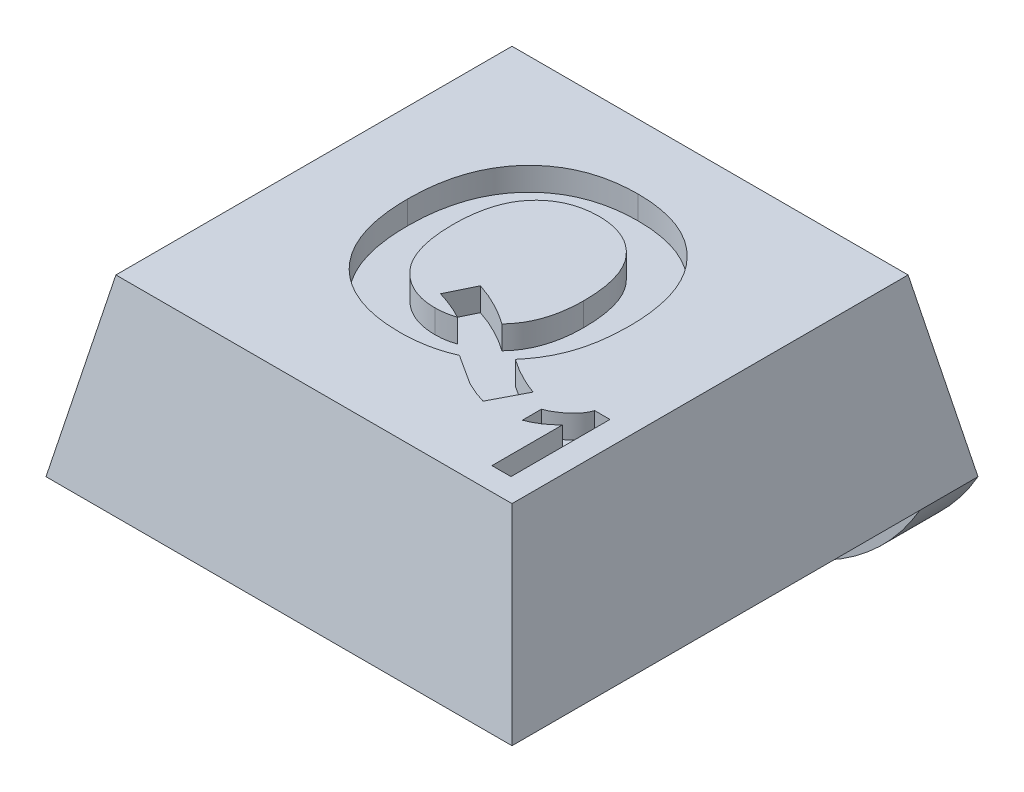
from build123d import *

# Parameters (mm, degrees)
SKETCH1_W               = 8
SKETCH1_H               = 8
BOSS_EXTRUDE1_DEPTH     = 3
CUT_EXTRUDE1_DEPTH      = 12.704699911
CUT_EXTRUDE1_DEPTH_BACK = 12.704699911
CUT_EXTRUDE2_DEPTH      = 11
SKETCH4_R               = 1.8
CUT_EXTRUDE3_DEPTH      = 0.8
SKETCH5_W               = 8
SKETCH5_H               = 1
BOSS_EXTRUDE2_DEPTH     = 2
FILLET1_R               = 4
CUT_EXTRUDE4_DEPTH      = 0.4
CUT_EXTRUDE5_DEPTH      = 0.4


with BuildPart() as part:
    # Sketch1 → Boss-Extrude1 (new body)
    with BuildSketch(Plane(origin=(0, 0, 0), x_dir=(1, 0, 0), z_dir=(0, 1, 0))):
        with Locations((4, 4)):
            Rectangle(SKETCH1_W, SKETCH1_H)
    extrude(amount=BOSS_EXTRUDE1_DEPTH)

    # Sketch2 → Cut-Extrude1 (cut, two sides: drawn at the far end of the back side and taken through both)
    with BuildSketch(Plane.XY.offset(-CUT_EXTRUDE1_DEPTH_BACK)):
        Polygon((0, 0), (0.6, 3), (0, 3), align=None)
        Polygon((8, 0), (7.4, 3), (8, 3), align=None)
    extrude(amount=CUT_EXTRUDE1_DEPTH + CUT_EXTRUDE1_DEPTH_BACK, mode=Mode.SUBTRACT)

    # Sketch3 → Cut-Extrude2 (cut)
    with BuildSketch(Plane(origin=(0, 0, 0), x_dir=(0, 0, -1), z_dir=(1, 0, 0))):
        Polygon((0, 0), (0.6, 3), (0, 3), align=None)
        Polygon((8, 3), (7.4, 3), (8, 0), align=None)
    extrude(amount=CUT_EXTRUDE2_DEPTH, mode=Mode.SUBTRACT)

    # Sketch4 → Cut-Extrude3 (cut)
    with BuildSketch(Plane.XZ):
        with Locations(Location((4, -3.75, 0), (0, 0, 270))):
            Circle(SKETCH4_R)
    extrude(amount=-CUT_EXTRUDE3_DEPTH, mode=Mode.SUBTRACT)

    # Sketch5 → Boss-Extrude2 (add)
    with BuildSketch(Plane.XZ):
        with Locations((4, -7.5)):
            Rectangle(SKETCH5_W, SKETCH5_H)
    extrude(amount=BOSS_EXTRUDE2_DEPTH)

    # Fillet1
    # the kernel refuses this fillet: 4 mm, written as the material it takes off along each edge
    with BuildSketch(Plane(origin=(8, -2, -16.660254038), x_dir=(0, 1, 0), z_dir=(0, 0, 1)), Plane(origin=(0, -2, 1.660254038), x_dir=(0, 1, 0), z_dir=(0, 0, -1))) as fillet1_piece_1:
        with BuildLine():
            CenterArc((4, 3.464101615), FILLET1_R, 180, 60)
            Line((0, 3.464101615), (-0.08, 3.464101615))
            Line((-0.08, 3.464101615), (-0.08, 0))
            Line((-0.08, 0), (0, -0.08))
            ThreePointArc((0, -0.08), (1, -0.08), (1.96, -0.069282032))
            Line((1.96, -0.069282032), (2, 0))
        make_face()
    extrude(amount=18.320508076, mode=Mode.SUBTRACT)

    # Sketch6 → Cut-Extrude4 (cut)
    with BuildSketch(Plane(origin=(0, 3, 0), x_dir=(1, 0, 0), z_dir=(0, 1, 0))):
        with BuildLine():
            add(Edge.make_bspline(
                [(5.284087955, 2.773445367), (5.333545491, 2.739545524), (5.432652736, 2.671614118), (5.590291823, 2.583736248), (5.752942084, 2.503846486), (5.865979951, 2.460876102), (5.92270975, 2.439310751)],
                knots=[0, 0, 0, 0, 0.994855506, 1.99357661, 2.993045438, 4, 4, 4, 4], degree=3))
            Line((5.92270975, 2.439310751), (5.628639237, 1.875208187))
            add(Edge.make_bspline(
                [(5.628639237, 1.875208187), (5.568520037, 1.893818156), (5.447325875, 1.93133395), (5.332925255, 1.986187111), (5.275273852, 2.013829982)],
                knots=[0, 0, 0, 0, 0.992113803, 2, 2, 2, 2], degree=3))
            add(Edge.make_bspline(
                [(5.275273852, 2.013829982), (5.26961656, 2.016684314), (5.253233801, 2.024950075), (5.223476786, 2.045298413), (5.178074812, 2.072724498), (5.118973761, 2.11071311), (5.045578888, 2.157800121), (4.95765273, 2.213934729), (4.856407872, 2.280704114), (4.783596416, 2.327731001), (4.744825134, 2.35277229)],
                knots=[0, 0, 0, 0, 0.241377655, 0.698997227, 1.371388316, 2.263975901, 3.376788369, 4.695767198, 6.240533187, 8, 8, 8, 8], degree=3))
            add(Edge.make_bspline(
                [(4.744825134, 2.35277229), (4.712670389, 2.339001865), (4.648050063, 2.311327899), (4.547788838, 2.27725121), (4.444978029, 2.248544986), (4.339982896, 2.224200245), (4.232359046, 2.206111381), (4.122258624, 2.192239309), (4.00937299, 2.18410397), (3.933139287, 2.183304154), (3.894664878, 2.182900495)],
                knots=[0, 0, 0, 0, 0.961025642, 1.931341354, 2.907359807, 3.893838693, 4.891829695, 5.905170566, 6.942759923, 8, 8, 8, 8], degree=3))
            add(Edge.make_bspline(
                [(3.894664878, 2.182900495), (3.821683976, 2.184676763), (3.679027131, 2.188148859), (3.471015208, 2.212756542), (3.275562804, 2.255408477), (3.091812023, 2.313667662), (2.920867424, 2.390147666), (2.761229426, 2.482594503), (2.615108223, 2.593406711), (2.480490537, 2.71918809), (2.361392609, 2.861354588), (2.257130725, 3.017424584), (2.168806746, 3.186880722), (2.097587685, 3.370615377), (2.041301668, 3.567142879), (2.002926315, 3.777850586), (1.978227581, 4.001488849), (1.975427333, 4.155321196), (1.973991801, 4.234182546)],
                knots=[0, 0, 0, 0, 1.098101164, 2.146474535, 3.146072545, 4.104420533, 5.041773038, 5.958565538, 6.874115049, 7.795336865, 8.725215067, 9.658214839, 10.614563411, 11.594512188, 12.618591104, 13.685899083, 14.813688224, 16, 16, 16, 16], degree=3))
            add(Edge.make_bspline(
                [(1.973991801, 4.234182546), (1.97543059, 4.313040679), (1.978227497, 4.466335509), (2.002757559, 4.689542909), (2.042412611, 4.899497801), (2.098124704, 5.096337583), (2.170410456, 5.279545107), (2.259079723, 5.449017762), (2.363505524, 5.605417057), (2.484015277, 5.747270094), (2.617919267, 5.874338646), (2.764464989, 5.984327234), (2.9219486, 6.078236158), (3.090996271, 6.154643933), (3.272074664, 6.212871015), (3.463805003, 6.255387163), (3.667248709, 6.280295733), (3.806454886, 6.283712517), (3.877837955, 6.285464598)],
                knots=[0, 0, 0, 0, 1.193283781, 2.319662245, 3.393996131, 4.424093603, 5.411284417, 6.369670503, 7.313761776, 8.251713527, 9.181123148, 10.102053383, 11.01932051, 11.951118596, 12.903560284, 13.893239571, 14.919681386, 16, 16, 16, 16], degree=3))
            add(Edge.make_bspline(
                [(3.877837955, 6.285464598), (3.948708316, 6.284176334), (4.086935049, 6.281663683), (4.288489067, 6.254790298), (4.478939684, 6.214016744), (4.658513444, 6.155241629), (4.826290277, 6.078911265), (4.983143341, 5.98623667), (5.128157857, 5.876434989), (5.26137487, 5.750578969), (5.380523981, 5.609215368), (5.486073462, 5.454669187), (5.572731816, 5.285035211), (5.645736122, 5.103191508), (5.700157026, 4.90736457), (5.740330715, 4.69867705), (5.764520815, 4.476471411), (5.76739165, 4.323719862), (5.768863596, 4.245400495)],
                knots=[0, 0, 0, 0, 1.078752742, 2.104017338, 3.091035458, 4.041673215, 4.975566109, 5.892967701, 6.810684895, 7.740128604, 8.678185021, 9.621404646, 10.583875016, 11.573429805, 12.6009998, 13.674031063, 14.80742018, 16, 16, 16, 16], degree=3))
            add(Edge.make_bspline(
                [(5.768863596, 4.245400495), (5.767275795, 4.16278925), (5.764189157, 4.002195454), (5.737326284, 3.768977018), (5.693780668, 3.550562854), (5.648918616, 3.41330904), (5.627036673, 3.346362034)],
                knots=[0, 0, 0, 0, 1.083667057, 2.106616435, 3.076482036, 4, 4, 4, 4], degree=3))
            add(Edge.make_bspline(
                [(5.627036673, 3.346362034), (5.607421404, 3.297050064), (5.567517691, 3.196733787), (5.488642668, 3.051933408), (5.394797316, 2.909076479), (5.321514211, 2.819296637), (5.284087955, 2.773445367)],
                knots=[0, 0, 0, 0, 0.948216854, 1.928975575, 2.942311585, 4, 4, 4, 4], degree=3))
        make_face()
        with BuildLine():
            add(Edge.make_bspline(
                [(4.642261032, 3.185304341), (4.671182259, 3.216922768), (4.72909393, 3.280235293), (4.800707281, 3.388678336), (4.863230922, 3.50497094), (4.912388312, 3.632014464), (4.951923574, 3.76787431), (4.97951585, 3.913560578), (4.996652709, 4.068707035), (4.998621406, 4.175375245), (4.999632827, 4.230176136)],
                knots=[0, 0, 0, 0, 0.906820982, 1.815812261, 2.745108282, 3.70056618, 4.696560745, 5.740060838, 6.83895416, 8, 8, 8, 8], degree=3))
            add(Edge.make_bspline(
                [(4.999632827, 4.230176136), (4.998745764, 4.286560817), (4.997027382, 4.395786947), (4.982794262, 4.554398979), (4.957747484, 4.70183414), (4.925058455, 4.838707416), (4.88052022, 4.963910999), (4.826807351, 5.078388614), (4.763835344, 5.182421929), (4.690056733, 5.274294514), (4.608907177, 5.355063587), (4.522159409, 5.426414517), (4.428546166, 5.486139657), (4.328544236, 5.534184829), (4.222990468, 5.571989212), (4.111634776, 5.59943433), (3.994225982, 5.615495039), (3.913944994, 5.6176829), (3.873030263, 5.618797931)],
                knots=[0, 0, 0, 0, 1.335693338, 2.587451293, 3.768164612, 4.876224393, 5.916940853, 6.910477009, 7.867661778, 8.790666633, 9.694493319, 10.576027549, 11.446684429, 12.318352473, 13.199023277, 14.098364444, 15.030842682, 16, 16, 16, 16], degree=3))
            add(Edge.make_bspline(
                [(3.873030263, 5.618797931), (3.831841607, 5.617719084), (3.751279942, 5.615608947), (3.633755604, 5.599158788), (3.522145798, 5.573035665), (3.416723766, 5.534932642), (3.316536446, 5.486796326), (3.222573421, 5.427181815), (3.134847786, 5.356951252), (3.053289548, 5.276692152), (2.980446173, 5.184790487), (2.915694165, 5.082568667), (2.862164439, 4.968850144), (2.819178201, 4.84427298), (2.784825228, 4.709477379), (2.760087026, 4.563739976), (2.745835322, 4.407279692), (2.744110931, 4.299383286), (2.74322257, 4.243797931)],
                knots=[0, 0, 0, 0, 0.980107447, 1.917010591, 2.819119613, 3.703969481, 4.579773866, 5.459928929, 6.346604172, 7.250235365, 8.177620171, 9.131899985, 10.124404622, 11.161948974, 12.264485933, 13.431998172, 14.677033863, 16, 16, 16, 16], degree=3))
            add(Edge.make_bspline(
                [(2.74322257, 4.243797931), (2.744089067, 4.187408458), (2.745771696, 4.077907007), (2.760333697, 3.91913972), (2.783941374, 3.771215716), (2.817547327, 3.634196218), (2.86051391, 3.507924697), (2.913437174, 3.392577112), (2.976036542, 3.288297709), (3.048513511, 3.196032652), (3.128245057, 3.114861766), (3.213441608, 3.04409835), (3.303411645, 2.983479498), (3.39857486, 2.934226809), (3.498956775, 2.896402137), (3.604207339, 2.869103357), (3.714939061, 2.852831885), (3.790443662, 2.850669982), (3.82895975, 2.849567162)],
                knots=[0, 0, 0, 0, 1.356840463, 2.634818045, 3.833173645, 4.958776583, 6.025986406, 7.038359119, 8.007356852, 8.946032033, 9.855123386, 10.740685277, 11.607120956, 12.460971081, 13.313368256, 14.183325659, 15.073285775, 16, 16, 16, 16], degree=3))
            add(Edge.make_bspline(
                [(3.82895975, 2.849567162), (3.857844622, 2.850073951), (3.914741814, 2.851072222), (3.998801079, 2.862293633), (4.080683558, 2.878515583), (4.133570622, 2.895033243), (4.159889237, 2.903253059)],
                knots=[0, 0, 0, 0, 1.028828871, 2.026578908, 3.017950568, 4, 4, 4, 4], degree=3))
            add(Edge.make_bspline(
                [(4.159889237, 2.903253059), (4.119539232, 2.924336443), (4.039635796, 2.966086993), (3.916101198, 3.019284802), (3.792319766, 3.067214804), (3.708133251, 3.09310976), (3.666299493, 3.105977418)],
                knots=[0, 0, 0, 0, 1.021704821, 2.023239566, 3.017713044, 4, 4, 4, 4], degree=3))
            Line((3.666299493, 3.105977418), (3.889857186, 3.56751588))
            add(Edge.make_bspline(
                [(3.889857186, 3.56751588), (3.955233958, 3.544923565), (4.086618506, 3.49952088), (4.276409331, 3.409366748), (4.463555304, 3.306758821), (4.582244486, 3.226093623), (4.642261032, 3.185304341)],
                knots=[0, 0, 0, 0, 0.979271047, 1.967993817, 2.972492781, 4, 4, 4, 4], degree=3))
        make_face(mode=Mode.SUBTRACT)
    extrude(amount=-CUT_EXTRUDE4_DEPTH, mode=Mode.SUBTRACT)

    # Sketch7 → Cut-Extrude5 (cut)
    with BuildSketch(Plane(origin=(0, 3, 0), x_dir=(1, 0, 0), z_dir=(0, 1, 0))):
        with BuildLine():
            Line((6.989609495, 0.992731968), (6.662686419, 0.992731968))
            Line((6.662686419, 0.992731968), (6.662686419, 2.203028442))
            add(Edge.make_bspline(
                [(6.662686419, 2.203028442), (6.647868508, 2.187985499), (6.618433709, 2.158103687), (6.571421698, 2.116422543), (6.522616062, 2.07764809), (6.471533827, 2.042148614), (6.418842766, 2.009418309), (6.364004407, 1.979715431), (6.307416238, 1.952628999), (6.268215163, 1.937491891), (6.248583854, 1.929911455)],
                knots=[0, 0, 0, 0, 1.012567276, 2.011397996, 3.011400399, 4.000747768, 4.993445519, 5.985067596, 6.990952157, 8, 8, 8, 8], degree=3))
            Line((6.248583854, 1.929911455), (6.248583854, 2.256834532))
            add(Edge.make_bspline(
                [(6.248583854, 2.256834532), (6.270355964, 2.264998139), (6.315923296, 2.282083933), (6.383165354, 2.318426283), (6.453350876, 2.363421778), (6.512310721, 2.40755194), (6.559122414, 2.44678718), (6.591840229, 2.478326157), (6.622155165, 2.510623705), (6.648927745, 2.544722271), (6.672860762, 2.579932457), (6.694066458, 2.616196741), (6.712732345, 2.65362968), (6.722503807, 2.679697149), (6.727389944, 2.692731968)],
                knots=[0, 0, 0, 0, 1.253673617, 2.623841347, 4.114270668, 5.751233548, 6.594491912, 7.409089316, 8.202422231, 8.983165545, 9.746111525, 10.498431446, 11.249153235, 12, 12, 12, 12], degree=3))
            Line((6.727389944, 2.692731968), (6.989609495, 2.692731968))
            Line((6.989609495, 2.692731968), (6.989609495, 0.992731968))
        make_face()
    extrude(amount=-CUT_EXTRUDE5_DEPTH, mode=Mode.SUBTRACT)


solid = part.part
